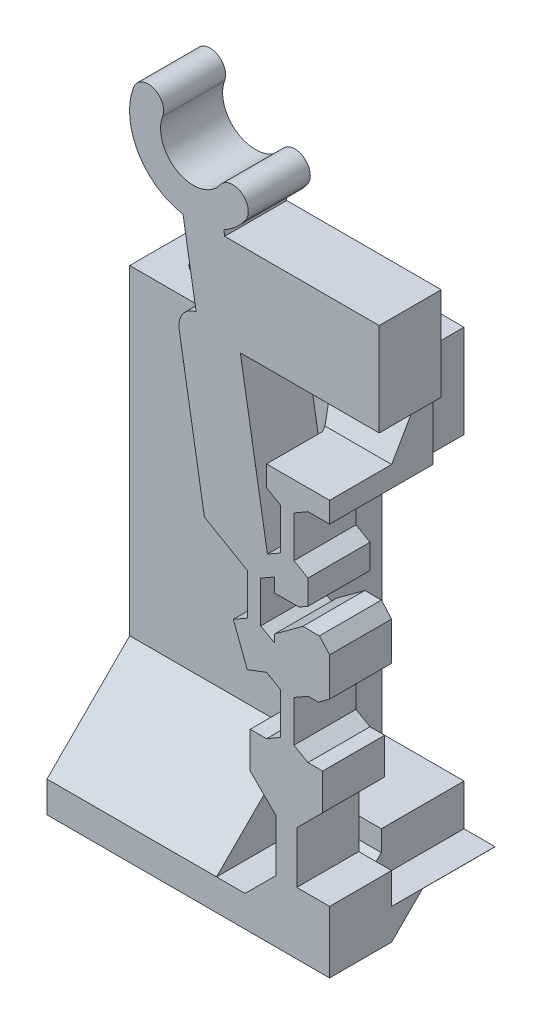
from build123d import *

# Parameters (mm, degrees)
BOSS_SWITCH_BODY_DEPTH                    = 3
SKETCH1_W                                 = 4.0875
SKETCH1_H                                 = 1.5
SKETCH1_W_2                               = 3.046903414
SKETCH1_H_2                               = 3.5
BOSS_FLANGE_WIDTH_DEPTH                   = 5
SKETCH2_W                                 = 4
SKETCH2_H                                 = 2
SKETCH2_W_2                               = 8
SKETCH2_H_2                               = 1.5
BOSS_FLANGE_HEIGHT_DEPTH                  = 10.620596586
CUT_UP_TO_DOWN_DERAILLEUR_CLEARANCE_REACH = 23.629
SKETCH10_W                                = 1.5
SKETCH10_H                                = 3
SKETCH17_W                                = 12.1675
SKETCH17_H                                = 4
BOSS_FLANGE_SUPPORT_DEPTH                 = 17.508325141
TAP_DRILL_FOR_M2X0_4_TAP1_D               = 1.6
M2_CLEARANCE_HOLE2_D                      = 2.4
M2_CLEARANCE_HOLE2_DEPTH                  = 15
M2_CLEARANCE_HOLE2_TIP                    = 0.721032743
CHAMFER_FLANGE_SUPPORT_SIZE               = 1.5
CHAMFER_FLANGE_SUPPORT_2_SIZE             = 1
SKETCH28_W                                = 3.046903414
SKETCH28_H                                = 2.5
CUT_EXTRUDE1_DEPTH                        = 1
CHAMFER10_SIZE                            = 1
CHAMFER10_SIZE2                           = 1.732050808
CHAMFER_FLANGE_SUPPORT_3_SIZE             = 1
CUT_EXTRUDE2_DEPTH                        = 34.862828732
CHAMFER12_SIZE                            = 0.5
CHAMFER12_SIZE2                           = 0.866025404
SKETCH23_W                                = 7.42721664
SKETCH23_H                                = 14.508325141
CUT_GAP_FOR_PRINTING_DEPTH                = 32.000499688
BOSS_EXTRUDE2_DEPTH                       = 8.2
CHAMFER11_SIZE                            = 0.75
CHAMFER11_SIZE_2                          = 1.299038106


# Some blends are built 0.0001 mm under size
with BuildPart() as part:
    # Sketch-SwitchBossUp → Boss-Switch Body (new body)
    with BuildSketch(Plane.XY):
        with BuildLine():
            Line((5.581091204, 12.554885442), (5.58109997, 11.370542897))
            Line((5.58109997, 11.370542897), (5.154266051, 11.12411022))
            Line((5.154266051, 11.12411022), (3.971266051, 11.12411022))
            Line((3.971266051, 11.12411022), (3.97126394, 11.79911022))
            Line((3.97126394, 11.79911022), (3.296271341, 11.409403061))
            Line((3.296271341, 11.409403061), (3.296271341, 9.409403061))
            Line((3.296271341, 9.409403061), (3.971278743, 9.019687356))
            Line((3.971278743, 9.019687356), (3.971278743, 9.409408058))
            Line((3.971278743, 9.409408058), (5.333511297, 10.40941814))
            Line((5.333511297, 10.40941814), (6.133511297, 10.409424062))
            Line((6.133511297, 10.409424062), (6.627976927, 9.860264345))
            Line((6.627976927, 9.860264345), (6.627976927, 8.007577878))
            Line((6.627976927, 8.007577878), (6.081127833, 7.606137899))
            Line((6.081127833, 7.606137899), (5.581127833, 7.606137899))
            Line((5.581127833, 7.606137899), (4.906138119, 7.216432406))
            Line((4.906138119, 7.216432406), (4.906138119, 5.216432406))
            Line((4.906138119, 5.216432406), (5.58114552, 4.826716701))
            Line((5.58114552, 4.826716701), (6.290476927, 4.826716701))
            Line((6.290476927, 4.826716701), (6.290476927, 3.076720436))
            Line((6.290476927, 3.076720436), (5.040476927, 1.826720436))
            Line((5.040476927, 1.826720436), (5.040476927, -0.673279564))
            Line((5.040476927, -0.673279564), (6.627976927, -0.673279564))
            Line((6.627976927, -0.673279564), (6.627976927, -3.673279564))
            Line((6.627976927, -3.673279564), (2.540476927, -3.673279564))
            Line((2.540476927, -3.673279564), (2.540476927, -2.173279564))
            Line((2.540476927, -2.173279564), (4.040476927, -0.673279564))
            Line((4.040476927, -0.673279564), (4.040476927, 1.826720436))
            Line((4.040476927, 1.826720436), (2.790476927, 3.076720436))
            Line((2.790476927, 3.076720436), (2.790476927, 4.826720436))
            Line((2.790476927, 4.826720436), (3.58114552, 4.826720436))
            Line((3.58114552, 4.826720436), (4.256138119, 5.216427595))
            Line((4.256138119, 5.216427595), (4.256138119, 7.216427595))
            Line((4.256138119, 7.216427595), (3.581130717, 7.6061433))
            Line((3.581130717, 7.6061433), (2.64686251, 7.249572244))
            Line((2.64686251, 7.249572244), (1.971281627, 9.019692757))
            Line((1.971281627, 9.019692757), (2.646271341, 9.40939825))
            Line((2.646271341, 9.40939825), (2.646271341, 11.40939825))
            Line((2.646271341, 11.40939825), (1.696557212, 11.957715958))
            Line((1.696557212, 11.957715958), (0.573317845, 12.60621851))
            Line((0.573317845, 12.60621851), (-0.645153605, 19.844362607))
            ThreePointArc((-0.645153605, 19.844362607), (-0.473707256, 20.590279886), (0.174966786, 20.996492176))
            Line((0.174966786, 20.996492176), (-0.46073685, 24.772792819))
            ThreePointArc((-0.46073685, 24.772792819), (-1.019582136, 24.919522879), (-1.541303694, 25.167805745))
            ThreePointArc((-1.541303694, 25.167805745), (-2.872284003, 26.795385437), (-2.852546321, 28.897797067))
            ThreePointArc((-2.852546321, 28.897797067), (-1.887813913, 29.338582026), (-1.447028953, 28.373849618))
            ThreePointArc((-1.447028953, 28.373849618), (-0.703448682, 26.416936722), (1.333779254, 26.898727173))
            ThreePointArc((1.333779254, 26.898727173), (2.379722745, 27.074801628), (2.555797201, 26.028858137))
            ThreePointArc((2.555797201, 26.028858137), (2.086504637, 25.507104397), (1.511513111, 25.104801997))
            Line((1.511513111, 25.104801997), (1.553598189, 24.854801997))
            Line((1.553598189, 24.854801997), (9.027976927, 24.854801997))
            Line((9.027976927, 24.854801997), (9.027976927, 22.354801997))
            Line((9.027976927, 22.354801997), (9.027976927, 20.354801997))
            Line((9.027976927, 20.354801997), (2.311129602, 20.354801997))
            Line((2.311129602, 20.354801997), (3.620242387, 12.578216848))
            Line((3.620242387, 12.578216848), (4.255457038, 12.944958198))
            Line((4.255457038, 12.944958198), (4.255457038, 14.944958198))
            Line((4.255457038, 14.944958198), (3.579805878, 15.335045577))
            Line((3.579805878, 15.335045577), (3.581073513, 15.335045577))
            Line((3.581073513, 15.335045577), (3.581073513, 16.335045577))
            Line((3.581073513, 16.335045577), (5.725580434, 16.335045577))
            Line((5.725580434, 16.335045577), (6.627976927, 16.335045577))
            Line((6.627976927, 16.335045577), (6.627976927, 15.335045577))
            Line((6.627976927, 15.335045577), (5.581099865, 15.335045577))
            Line((5.581099865, 15.335045577), (4.905457038, 14.944963009))
            Line((4.905457038, 14.944963009), (4.905457038, 12.944963009))
            Line((4.905457038, 12.944963009), (5.581091204, 12.554885442))
        make_face()
    extrude(amount=BOSS_SWITCH_BODY_DEPTH)

    # Sketch1 → Boss-Flange Width (add)
    with BuildSketch(Plane(origin=(0, 0, 0), x_dir=(-1, 0, 0), z_dir=(0, 0, -1))):
        with Locations((-4.584226927, -2.923279564)):
            Rectangle(SKETCH1_W, SKETCH1_H)
        with Locations((-5.10452522, 17.085045577)):
            Rectangle(SKETCH1_W_2, SKETCH1_H_2)
    extrude(amount=BOSS_FLANGE_WIDTH_DEPTH)

    # Sketch2 → Boss-Flange Height (add)
    with BuildSketch(Plane(origin=(-7.039523073, 0, 0), x_dir=(0, 0, -1), z_dir=(1, 0, 0))):
        with Locations((3, 16.335045577)):
            Rectangle(SKETCH2_W, SKETCH2_H)
        with Locations((1, -2.923279564)):
            Rectangle(SKETCH2_W_2, SKETCH2_H_2)
    extrude(amount=BOSS_FLANGE_HEIGHT_DEPTH)

    # Sketch10 → Cut-Up-To-Down Derailleur Clearance (cut, up to next)
    with BuildSketch(Plane(origin=(0, 15.335045577, 0), x_dir=(1, 0, 0), z_dir=(0, 1, 0)), mode=Mode.PRIVATE) as cut_up_to_down_derailleur_clearance_sk1:
        with Locations((5.877976927, 3.5)):
            Rectangle(SKETCH10_W, SKETCH10_H)
    cut_up_to_down_derailleur_clearance_tool1 = extrude(cut_up_to_down_derailleur_clearance_sk1.sketch, amount=CUT_UP_TO_DOWN_DERAILLEUR_CLEARANCE_REACH, mode=Mode.PRIVATE) & part.part
    add(cut_up_to_down_derailleur_clearance_tool1.solids().sort_by_distance((5.877977, 15.335046, -3.5))[0], mode=Mode.SUBTRACT)

    # Sketch17 → Boss-Flange Support (add)
    with BuildSketch(Plane.XZ.offset(-15.335045577)):
        with Locations((-0.955773073, -3)):
            Rectangle(SKETCH17_W, SKETCH17_H)
    extrude(amount=BOSS_FLANGE_SUPPORT_DEPTH)

    # Tap Drill for M2x0.4 Tap1 (through all)
    with Locations(Plane(origin=(0, -3.673279564, 0), x_dir=(-1, 0, 0), z_dir=(0, -1, 0))):
        with Locations((5.039523073, 3), (0.539523073, 3)):
            Hole(TAP_DRILL_FOR_M2X0_4_TAP1_D / 2)

    # M2 Clearance Hole2
    with Locations(Plane.XZ.offset(3.673279564)):
        with Locations((-5.039523073, -3), (-0.539523073, -3)):
            Hole(M2_CLEARANCE_HOLE2_D / 2, depth=M2_CLEARANCE_HOLE2_DEPTH)
            with Locations((0, 0, -(M2_CLEARANCE_HOLE2_DEPTH + M2_CLEARANCE_HOLE2_TIP / 2))):  # 118° drill point
                Cone(0, M2_CLEARANCE_HOLE2_D / 2, M2_CLEARANCE_HOLE2_TIP, mode=Mode.SUBTRACT)

    # Chamfer-Flange Support
    chamfer_flange_support_edges = [part.edges().sort_by_distance(p)[0] for p in [
        (3.581073513, 17.335045577, -3),
    ]]
    chamfer(chamfer_flange_support_edges, length=CHAMFER_FLANGE_SUPPORT_SIZE - 0.0001)  # a hair under: the kernel refuses the full size

    # Chamfer-Flange Support 2
    chamfer_flange_support_2_edges = [part.edges().sort_by_distance(p)[0] for p in [
        (5.127976927, 17.085045577, -2),
        (5.127976927, 15.335045577, -1.5),
    ]]
    chamfer(chamfer_flange_support_2_edges, length=CHAMFER_FLANGE_SUPPORT_2_SIZE)

    # Sketch28 → Cut-Extrude1 (cut)
    with BuildSketch(Plane.XY.offset(-1)):
        with Locations((5.10452522, 17.585045577)):
            Rectangle(SKETCH28_W, SKETCH28_H)
    extrude(amount=CUT_EXTRUDE1_DEPTH, mode=Mode.SUBTRACT)

    # Chamfer10
    chamfer10_edges = [part.edges().sort_by_distance(p)[0] for p in [
        (5.10452522, 16.335045577, -1),
    ]]
    chamfer10_side = [part.faces().sort_by_distance(p)[0] for p in [
        (5.10452522, 16.335045577, 1),
    ]]
    chamfer(chamfer10_edges, length=CHAMFER10_SIZE, length2=CHAMFER10_SIZE2, reference=chamfer10_side[0])

    # Chamfer-Flange Support 3
    chamfer_flange_support_3_edges = [part.edges().sort_by_distance(p)[0] for p in [
        (-0.955773073, -2.173279564, -1),
    ]]
    chamfer(chamfer_flange_support_3_edges, length=CHAMFER_FLANGE_SUPPORT_3_SIZE - 0.0001)  # a hair under: the kernel refuses the full size

    # Sketch31 → Cut-Extrude2 (cut, through all)
    with BuildSketch(Plane.ZY.offset(7.039523073)):
        Polygon((-5, -2.180661432), (-5, -3.673279564), (0, -3.673279564), (-1.492618132, -2.180661432), align=None)
    extrude(amount=-CUT_EXTRUDE2_DEPTH, mode=Mode.SUBTRACT)

    # Chamfer12
    chamfer12_edges = [part.edges().sort_by_distance(p)[0] for p in [
        (4.85452522, 15.335045577, -1),
    ]]
    chamfer12_side = [part.faces().sort_by_distance(p)[0] for p in [
        (5.669366922, 15.335045577, 0.364483359),
    ]]
    chamfer(chamfer12_edges, length=CHAMFER12_SIZE, length2=CHAMFER12_SIZE2, reference=chamfer12_side[0])

    # Sketch23 → Cut-Gap for Printing (cut, through all)
    with BuildSketch(Plane.XY.offset(-1)):
        with Locations((4.874085247, 7.080883007)):
            Rectangle(SKETCH23_W, SKETCH23_H)
    extrude(amount=-CUT_GAP_FOR_PRINTING_DEPTH, mode=Mode.SUBTRACT)

    # Sketch32 → Boss-Extrude2 (add)
    with BuildSketch(Plane.ZY.offset(7.039523073)):
        Polygon((3, -2.173279564), (-1, 1.826720436), (-1, -2.082793031), (0.406297605, -3.355496176), (3, -3.355496176), align=None)
    extrude(amount=-BOSS_EXTRUDE2_DEPTH)

    # Chamfer11
    # the kernel refuses this chamfer: 1.299038106, 0.75 mm, written as the material it adds along each edge
    with BuildSketch(Plane(origin=(3.581073513, 11.108297196, -1), x_dir=(-0.9983227437537926, 0, -0.05789386240267147), z_dir=(0, 1, 0))) as chamfer11_piece_1_section:
        Polygon((CHAMFER11_SIZE * 0.998322743754, CHAMFER11_SIZE * 0.0578938624027), (-CHAMFER11_SIZE_2 * 0.0578938623883, CHAMFER11_SIZE_2 * 0.998322743505), (0, 0), align=None)
    chamfer11_piece_1 = extrude(amount=5.226748382, mode=Mode.PRIVATE)
    chamfer11_piece_1 = split(chamfer11_piece_1, bisect_by=Plane(origin=(3.144000621, 15.335045577, -0.473759617), z_dir=(1.4013159114223785e-12, 1.0, 0)), keep=Keep.TOP, mode=Mode.PRIVATE)
    add(chamfer11_piece_1)
    with BuildSketch(Plane(origin=(3.581073513, 11.108297196, -1), x_dir=(-0.9983227437537926, 0, -0.05789386240267147), z_dir=(0, 1, 0))) as chamfer11_piece_2_section:
        Polygon((CHAMFER11_SIZE * 0.998322743754, CHAMFER11_SIZE * 0.0578938624027), (-CHAMFER11_SIZE_2 * 0.0578938623883, CHAMFER11_SIZE_2 * 0.998322743505), (0, 0), align=None)
    chamfer11_piece_2 = extrude(amount=5.226748382, mode=Mode.PRIVATE)
    chamfer11_piece_2 = split(chamfer11_piece_2, bisect_by=Plane(origin=(3.059810406, 14.920794757, -0.739167823), z_dir=(0, 0.4999999999999982, -0.8660254037844397)), keep=Keep.TOP, mode=Mode.PRIVATE)
    add(chamfer11_piece_2)
    with BuildSketch(Plane(origin=(3.581073513, 16.335045577, -1), x_dir=(-0.9983227437537926, 0, -0.05789386240267147), z_dir=(0, 1, 0))) as chamfer11_piece_3_section:
        Polygon((CHAMFER11_SIZE * 0.998322743754, CHAMFER11_SIZE * 0.0578938624027), (-CHAMFER11_SIZE_2 * 0.0578938623883, CHAMFER11_SIZE_2 * 0.998322743505), (0, 0), align=None)
    chamfer11_piece_3 = extrude(amount=5.092773786, mode=Mode.PRIVATE)
    chamfer11_piece_3 = split(chamfer11_piece_3, bisect_by=Plane(origin=(3.285691508, 17.119009851, -0.452621985), z_dir=(0, -0.4999999999999982, -0.8660254037844397)), keep=Keep.TOP, mode=Mode.PRIVATE)
    add(chamfer11_piece_3)


solid = part.part
